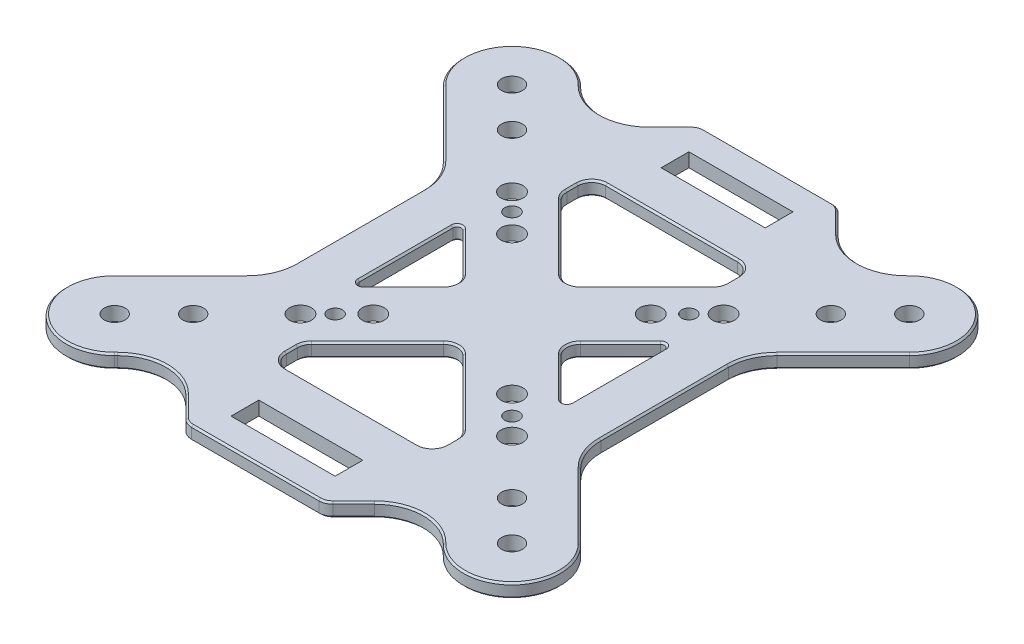
from build123d import *

# Parameters (mm, degrees)
SKETCH1_R           = 1.5
SKETCH1_R_2         = 1.575
SKETCH1_R_3         = 1.05
BOSS_EXTRUDE1_DEPTH = 2
MIRROR1_OUTLINE_R   = 1.5
MIRROR1_OUTLINE_R_2 = 1.575
MIRROR1_OUTLINE_R_3 = 1.05
MIRROR1_OUTLINE_W   = 15
MIRROR1_OUTLINE_H   = 4
MIRROR1_DEPTH       = 2
FILLET1_R           = 2
FILLET2_R           = 0.6
CHAMFER1_SIZE       = 0.25


# Read off the part's stored shape, not the designer's step: Mirror1
with BuildPart() as part:
    # Sketch1 → Boss-Extrude1 (new body)
    with BuildSketch(Plane(origin=(0, 0, 0), x_dir=(1, 0, 0), z_dir=(0, 1, 0))):
        with BuildLine():
            Line((-7.071067812, 0), (0, 0))
            Line((0, 0), (0, 7.071067812))
            Line((0, 7.071067812), (-11.5, 18.571067812))
            Line((-11.5, 18.571067812), (-11.5, 23))
            Line((-11.5, 23), (0, 23))
            Line((0, 23), (0, 29))
            Line((0, 29), (-7.5, 29))
            Line((-7.5, 29), (-7.5, 33))
            Line((-7.5, 33), (0, 33))
            Line((0, 33), (0, 37))
            Line((0, 37), (-9.171572875, 37))
            ThreePointArc((-9.171572875, 37), (-9.93693974, 36.847759065), (-10.585786438, 36.414213562))
            Line((-10.585786438, 36.414213562), (-13.600505063, 33.399494937))
            ThreePointArc((-13.600505063, 33.399494937), (-18.550252532, 31.349242405), (-23.5, 33.399494937))
            Line((-23.5, 33.399494937), (-23.68807717, 33.587572106))
            ThreePointArc((-23.68807717, 33.587572106), (-33.587572106, 33.587572106), (-33.587572106, 23.68807717))
            Line((-33.587572106, 23.68807717), (-24.050252532, 14.150757595))
            ThreePointArc((-24.050252532, 14.150757595), (-22.532843272, 11.879794153), (-22, 9.201010127))
            Line((-22, 9.201010127), (-22, 0))
            Line((-22, 0), (-15.25, 0))
            Line((-15.25, 0), (-15.25, 8.178932188))
            Line((-15.25, 8.178932188), (-7.071067812, 0))
        make_face()
        with Locations(Location((-22.980970389, 22.980970389, 0), (0, 0, 270))):
            Circle(SKETCH1_R, mode=Mode.SUBTRACT)
        with Locations(Location((-28.637824638, 28.637824638, 0), (0, 0, 270))):
            Circle(SKETCH1_R, mode=Mode.SUBTRACT)
        with Locations(Location((-15.25, 15.25, 0), (0, 0, 270))):
            Circle(SKETCH1_R_2, mode=Mode.SUBTRACT)
        with Locations(Location((-12.75, 12.75, 0), (0, 0, 270))):
            Circle(SKETCH1_R_3, mode=Mode.SUBTRACT)
        with Locations(Location((-10, 10, 0), (0, 0, 270))):
            Circle(SKETCH1_R_2, mode=Mode.SUBTRACT)
    extrude(amount=BOSS_EXTRUDE1_DEPTH)

    # Mirror1 outline → Mirror1 (add)
    with BuildSketch(Plane(origin=(0, 0, 0), x_dir=(1, 0, 0), z_dir=(0, 1, 0))):
        with BuildLine():
            Line((33.587572106, -23.68807717), (24.050252532, -14.150757595))
            ThreePointArc((24.050252532, -14.150757595), (22.532843272, -11.879794154), (22, -9.201010127))
            Line((22, -9.201010127), (22, 9.201010127))
            ThreePointArc((22, 9.201010127), (22.532843272, 11.879794154), (24.050252532, 14.150757595))
            Line((24.050252532, 14.150757595), (33.587572106, 23.68807717))
            ThreePointArc((33.587572106, 23.68807717), (33.587572106, 33.587572106), (23.68807717, 33.587572106))
            Line((23.68807717, 33.587572106), (23.5, 33.399494937))
            ThreePointArc((23.5, 33.399494937), (18.550252531, 31.349242405), (13.600505063, 33.399494937))
            Line((13.600505063, 33.399494937), (10.585786438, 36.414213562))
            ThreePointArc((10.585786438, 36.414213562), (9.93693974, 36.847759065), (9.171572875, 37))
            Line((9.171572875, 37), (0, 37))
            Line((0, 37), (0, 33))
            Line((0, 33), (7.5, 33))
            Line((7.5, 33), (7.5, 29))
            Line((7.5, 29), (0, 29))
            Line((0, 29), (0, 23))
            Line((0, 23), (11.5, 23))
            Line((11.5, 23), (11.5, 18.571067812))
            Line((11.5, 18.571067812), (0, 7.071067812))
            Line((0, 7.071067812), (0, 0))
            Line((0, 0), (-7.071067812, 0))
            Line((-7.071067812, 0), (-15.25, -8.178932188))
            Line((-15.25, -8.178932188), (-15.25, 0))
            Line((-15.25, 0), (-22, 0))
            Line((-22, 0), (-22, -9.201010127))
            ThreePointArc((-22, -9.201010127), (-22.532843272, -11.879794154), (-24.050252532, -14.150757595))
            Line((-24.050252532, -14.150757595), (-33.587572106, -23.68807717))
            ThreePointArc((-33.587572106, -23.68807717), (-33.587572106, -33.587572106), (-23.68807717, -33.587572106))
            Line((-23.68807717, -33.587572106), (-23.5, -33.399494937))
            ThreePointArc((-23.5, -33.399494937), (-18.550252531, -31.349242405), (-13.600505063, -33.399494937))
            Line((-13.600505063, -33.399494937), (-10.585786438, -36.414213562))
            ThreePointArc((-10.585786438, -36.414213562), (-9.93693974, -36.847759065), (-9.171572875, -37))
            Line((-9.171572875, -37), (9.171572875, -37))
            ThreePointArc((9.171572875, -37), (9.93693974, -36.847759065), (10.585786438, -36.414213562))
            Line((10.585786438, -36.414213562), (13.600505063, -33.399494937))
            ThreePointArc((13.600505063, -33.399494937), (18.550252531, -31.349242405), (23.5, -33.399494937))
            Line((23.5, -33.399494937), (23.68807717, -33.587572106))
            ThreePointArc((23.68807717, -33.587572106), (33.587572106, -33.587572106), (33.587572106, -23.68807717))
        make_face()
        with Locations((-28.637824638, -28.637824638)):
            Circle(MIRROR1_OUTLINE_R, mode=Mode.SUBTRACT)
        with Locations((-22.980970389, -22.980970389)):
            Circle(MIRROR1_OUTLINE_R, mode=Mode.SUBTRACT)
        with Locations((-15.25, -15.25)):
            Circle(MIRROR1_OUTLINE_R_2, mode=Mode.SUBTRACT)
        with Locations((-12.75, -12.75)):
            Circle(MIRROR1_OUTLINE_R_3, mode=Mode.SUBTRACT)
        with Locations((-10, -10)):
            Circle(MIRROR1_OUTLINE_R_2, mode=Mode.SUBTRACT)
        with Locations((0, -31)):
            Rectangle(MIRROR1_OUTLINE_W, MIRROR1_OUTLINE_H, mode=Mode.SUBTRACT)
        with Locations((28.637824638, -28.637824638)):
            Circle(MIRROR1_OUTLINE_R, mode=Mode.SUBTRACT)
        with Locations((22.980970389, -22.980970389)):
            Circle(MIRROR1_OUTLINE_R, mode=Mode.SUBTRACT)
        Polygon((-11.5, -18.571067812), (0, -7.071067812), (11.5, -18.571067812), (11.5, -23), (-11.5, -23), align=None, mode=Mode.SUBTRACT)
        with Locations((15.25, -15.25)):
            Circle(MIRROR1_OUTLINE_R_2, mode=Mode.SUBTRACT)
        with Locations((12.75, -12.75)):
            Circle(MIRROR1_OUTLINE_R_3, mode=Mode.SUBTRACT)
        with Locations((10, -10)):
            Circle(MIRROR1_OUTLINE_R_2, mode=Mode.SUBTRACT)
        Polygon((15.25, -8.178932188), (7.071067812, 0), (15.25, 8.178932188), align=None, mode=Mode.SUBTRACT)
        with Locations((10, 10)):
            Circle(MIRROR1_OUTLINE_R_2, mode=Mode.SUBTRACT)
        with Locations((12.75, 12.75)):
            Circle(MIRROR1_OUTLINE_R_3, mode=Mode.SUBTRACT)
        with Locations((15.25, 15.25)):
            Circle(MIRROR1_OUTLINE_R_2, mode=Mode.SUBTRACT)
        with Locations((22.980970389, 22.980970389)):
            Circle(MIRROR1_OUTLINE_R, mode=Mode.SUBTRACT)
        with Locations((28.637824638, 28.637824638)):
            Circle(MIRROR1_OUTLINE_R, mode=Mode.SUBTRACT)
    extrude(amount=MIRROR1_DEPTH)

    # Fillet1
    fillet1_edges = [part.edges().sort_by_distance(p)[0] for p in [
        (-11.5, 1, 23),
        (-11.5, 1, 18.571067812),
        (0, 1, 7.071067812),
        (11.5, 1, 18.571067812),
        (11.5, 1, 23),
        (-11.5, 1, -23),
        (-11.5, 1, -18.571067812),
        (0, 1, -7.071067812),
        (-7.071067812, 1, 0),
        (11.5, 1, -23),
        (11.5, 1, -18.571067812),
        (7.071067812, 1, 0),
    ]]
    fillet(fillet1_edges, radius=FILLET1_R)

    # Fillet2
    fillet2_edges = [part.edges().sort_by_distance(p)[0] for p in [
        (-15.25, 1, 8.178932188),
        (15.25, 1, 8.178932188),
        (-15.25, 1, -8.178932188),
        (15.25, 1, -8.178932188),
    ]]
    fillet(fillet2_edges, radius=FILLET2_R)

    # Chamfer1
    chamfer1_edges = [part.edges().sort_by_distance(p)[0] for p in [
        (-23.594038585, 2, -33.493533521),
        (-9.93693974, 2, -36.847759065),
        (-12.093145751, 2, -34.906854249),
        (-18.550252532, 2, -31.349242405),
        (-23.594038585, 0, 33.493533521),
        (-18.550252531, 0, 31.349242405),
        (-12.09314575, 2, 34.90685425),
        (-9.93693974, 2, 36.847759065),
        (0, 2, 37),
        (-22.532843272, 0, 11.879794154),
        (-28.818912319, 2, 18.919417383),
        (-33.587572106, 2, 33.587572106),
        (-23.594038585, 2, 33.493533521),
        (-18.550252531, 2, 31.349242405),
        (-33.587572106, 2, -33.587572106),
        (-22.532843272, 2, 11.879794154),
        (-33.587572106, 0, 33.587572106),
        (-28.818912319, 0, 18.919417383),
        (0, 0, 37),
        (-9.93693974, 0, 36.847759065),
        (-12.09314575, 0, 34.90685425),
        (23.594038585, 2, 33.493533521),
        (33.587572106, 0, 33.587572106),
        (28.818912319, 0, 18.919417383),
        (22.532843272, 2, 11.879794154),
        (9.93693974, 0, 36.847759065),
        (12.09314575, 0, 34.90685425),
        (18.550252531, 2, 31.349242405),
        (33.587572106, 2, 33.587572106),
        (28.818912319, 2, 18.919417383),
        (9.93693974, 2, 36.847759065),
        (12.09314575, 2, 34.90685425),
        (23.594038585, 0, 33.493533521),
        (18.550252531, 0, 31.349242405),
        (22.532843272, 0, 11.879794154),
        (-28.818912319, 2, -18.919417382),
        (-22.532843272, 2, -11.879794153),
        (6.164213562, 0, 13.235281374),
        (6.164213562, 2, 13.235281374),
        (-6.164213562, 0, 13.235281374),
        (-6.164213562, 2, 13.235281374),
        (-6.164213562, 0, -13.235281374),
        (-6.164213562, 2, -13.235281374),
        (6.164213562, 0, -13.235281374),
        (6.164213562, 2, -13.235281374),
        (-11.5, 0, -20.199747468),
        (-11.5, 2, -20.199747468),
        (11.5, 0, -20.199747468),
        (11.5, 2, -20.199747468),
        (11.5, 0, 20.199747468),
        (11.5, 2, 20.199747468),
        (-11.5, 0, 20.199747468),
        (-11.5, 2, 20.199747468),
        (0, 0, 23),
        (0, 2, 23),
        (0, 0, -23),
        (0, 2, -23),
        (-7.899494937, 0, 0),
        (-7.899494937, 2, 0),
        (7.899494937, 0, 0),
        (-22, 2, 0),
        (7.899494937, 2, 0),
        (0, 0, 7.899494937),
        (0, 2, 7.899494937),
        (0, 0, -7.899494937),
        (0, 2, -7.899494937),
        (-11.347759065, 0, -18.634128072),
        (-11.347759065, 2, -18.634128072),
        (11.347759065, 0, -18.634128072),
        (11.347759065, 2, -18.634128072),
        (11.347759065, 0, 18.634128072),
        (11.347759065, 2, 18.634128072),
        (-18.550252532, 0, -31.349242405),
        (-11.347759065, 0, 18.634128072),
        (-11.347759065, 2, 18.634128072),
        (-12.093145751, 0, -34.906854249),
        (-10.914213562, 0, 22.414213562),
        (-10.914213562, 2, 22.414213562),
        (10.914213562, 0, 22.414213562),
        (-9.93693974, 0, -36.847759065),
        (10.914213562, 2, 22.414213562),
        (10.914213562, 0, -22.414213562),
        (0, 0, -37),
        (10.914213562, 2, -22.414213562),
        (-10.914213562, 0, -22.414213562),
        (-10.914213562, 2, -22.414213562),
        (-22, 0, 0),
        (-22.532843272, 0, -11.879794153),
        (11.355508653, 0, 4.284440841),
        (11.355508653, 2, 4.284440841),
        (-28.818912319, 0, -18.919417382),
        (15.25, 0, 0),
        (15.25, 2, 0),
        (11.355508653, 2, -4.284440841),
        (11.355508653, 0, -4.284440841),
        (-15.25, 0, 0),
        (-15.25, 2, 0),
        (-33.587572106, 0, -33.587572106),
        (-11.355508653, 2, 4.284440841),
        (-11.355508653, 0, 4.284440841),
        (-11.355508653, 0, -4.284440841),
        (-11.355508653, 2, -4.284440841),
        (14.879610059, 0, 7.28473177),
        (14.879610059, 2, 7.28473177),
        (-23.594038585, 0, -33.493533521),
        (14.879610059, 0, -7.28473177),
        (14.879610059, 2, -7.28473177),
        (-14.879610059, 0, 7.28473177),
        (-14.879610059, 2, 7.28473177),
        (-14.879610059, 0, -7.28473177),
        (-14.879610059, 2, -7.28473177),
        (23.594038585, 0, -33.493533521),
        (18.550252531, 0, -31.349242405),
        (12.09314575, 2, -34.90685425),
        (9.93693974, 2, -36.847759065),
        (22, 0, 0),
        (22.532843272, 0, -11.879794154),
        (28.818912319, 2, -18.919417383),
        (33.587572106, 2, -33.587572106),
        (23.594038585, 2, -33.493533521),
        (18.550252531, 2, -31.349242405),
        (22, 2, 0),
        (22.532843272, 2, -11.879794154),
        (0, 2, -37),
        (33.587572106, 0, -33.587572106),
        (28.818912319, 0, -18.919417383),
        (9.93693974, 0, -36.847759065),
        (12.09314575, 0, -34.90685425),
    ]]
    chamfer(chamfer1_edges, length=CHAMFER1_SIZE)


solid = part.part
